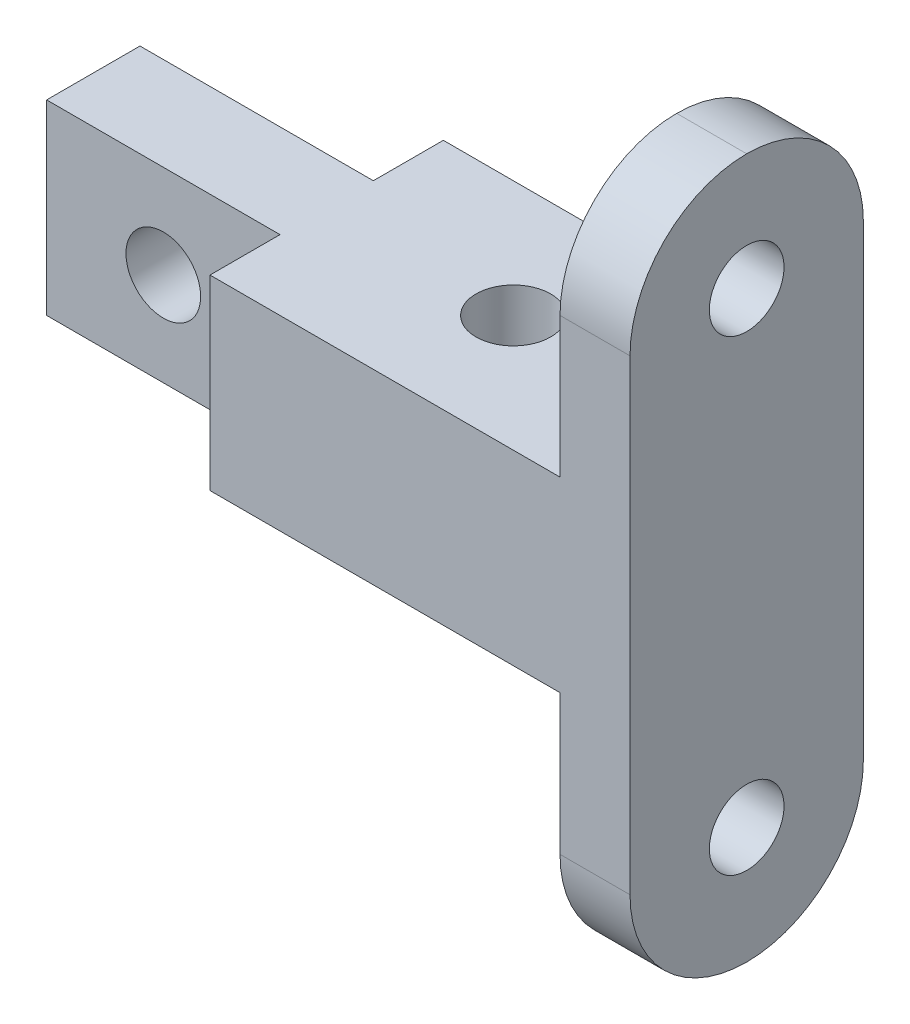
from build123d import *

# Parameters (mm, degrees)
BOSS_EXTRU_1_DEPTH      = 10
ESQUISSE2_R             = 1.6
ENL_V_MAT_EXTRU_1_DEPTH = 10
CONG_1_R                = 5
ESQUISSE3_W             = 10
ESQUISSE3_H             = 3
ENL_V_MAT_EXTRU_2_DEPTH = 10
ESQUISSE4_R             = 1.6
ENL_V_MAT_EXTRU_3_DEPTH = 10
ESQUISSE5_R             = 1.6
ENL_V_MAT_EXTRU_4_DEPTH = 10


with BuildPart() as part:
    # Esquisse1 → Boss.-Extru.1 (new body)
    with BuildSketch(Plane.XY):
        Polygon((6, -4), (6, -15), (9, -15), (9, 15), (6, 15), (6, 4), (-19, 4), (-19, -4), align=None)
    extrude(amount=BOSS_EXTRU_1_DEPTH)

    # Esquisse2 → Enlèv. mat.-Extru.1 (cut)
    with BuildSketch(Plane.ZY.offset(-6)):
        with Locations(Location((5, 10, 0), (0, 0, 270))):
            Circle(ESQUISSE2_R)
    enl_v_mat_extru_1 = extrude(amount=-ENL_V_MAT_EXTRU_1_DEPTH, mode=Mode.SUBTRACT)

    # Symétrie3: Enlèv. mat.-Extru.1 across plane
    add(enl_v_mat_extru_1.mirror(Plane.ZX), mode=Mode.SUBTRACT)

    # Congé1
    cong_1_edges = [part.edges().sort_by_distance(p)[0] for p in [
        (7.5, 15, 0),
        (7.5, 15, 10),
        (7.5, -15, 0),
        (7.5, -15, 10),
    ]]
    fillet(cong_1_edges, radius=CONG_1_R - 0.0001)  # a hair under: the kernel refuses the full size

    # Esquisse3 → Enlèv. mat.-Extru.2 (cut)
    with BuildSketch(Plane(origin=(0, 4, 0), x_dir=(1, 0, 0), z_dir=(0, 1, 0))):
        with Locations((-14, -1.5)):
            Rectangle(ESQUISSE3_W, ESQUISSE3_H)
        with Locations((-14, -8.5)):
            Rectangle(ESQUISSE3_W, ESQUISSE3_H)
    extrude(amount=-ENL_V_MAT_EXTRU_2_DEPTH, mode=Mode.SUBTRACT)

    # Esquisse4 → Enlèv. mat.-Extru.3 (cut)
    with BuildSketch(Plane(origin=(0, 0, 3), x_dir=(-1, 0, 0), z_dir=(0, 0, -1))):
        with Locations((14, 0)):
            Circle(ESQUISSE4_R)
    extrude(amount=-ENL_V_MAT_EXTRU_3_DEPTH, mode=Mode.SUBTRACT)

    # Esquisse5 → Enlèv. mat.-Extru.4 (cut)
    with BuildSketch(Plane.XZ.offset(4)):
        with Locations((-1, 5)):
            Circle(ESQUISSE5_R)
    extrude(amount=-ENL_V_MAT_EXTRU_4_DEPTH, mode=Mode.SUBTRACT)


solid = part.part
